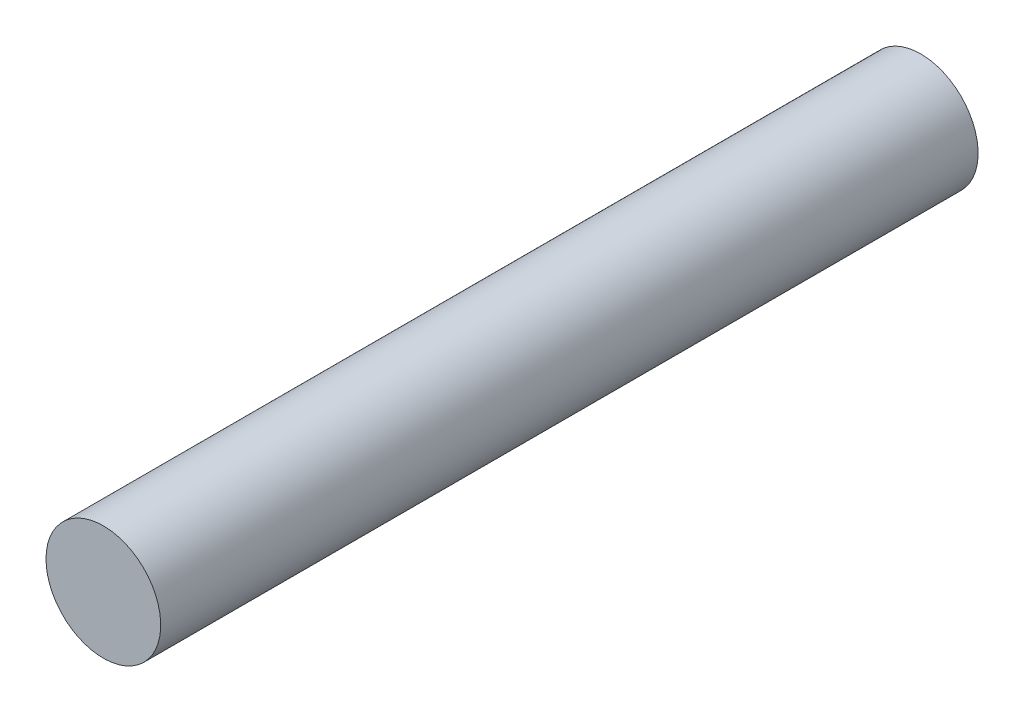
from build123d import *

# Parameters (mm, degrees)
SKETCH_1_R      = 4
EXTRUDE_1_DEPTH = 57


with BuildPart() as part:
    # Эскиз1 → Вытянуть1 (new body)
    with BuildSketch(Plane.XY):
        Circle(SKETCH_1_R)
    extrude(amount=EXTRUDE_1_DEPTH)


solid = part.part
